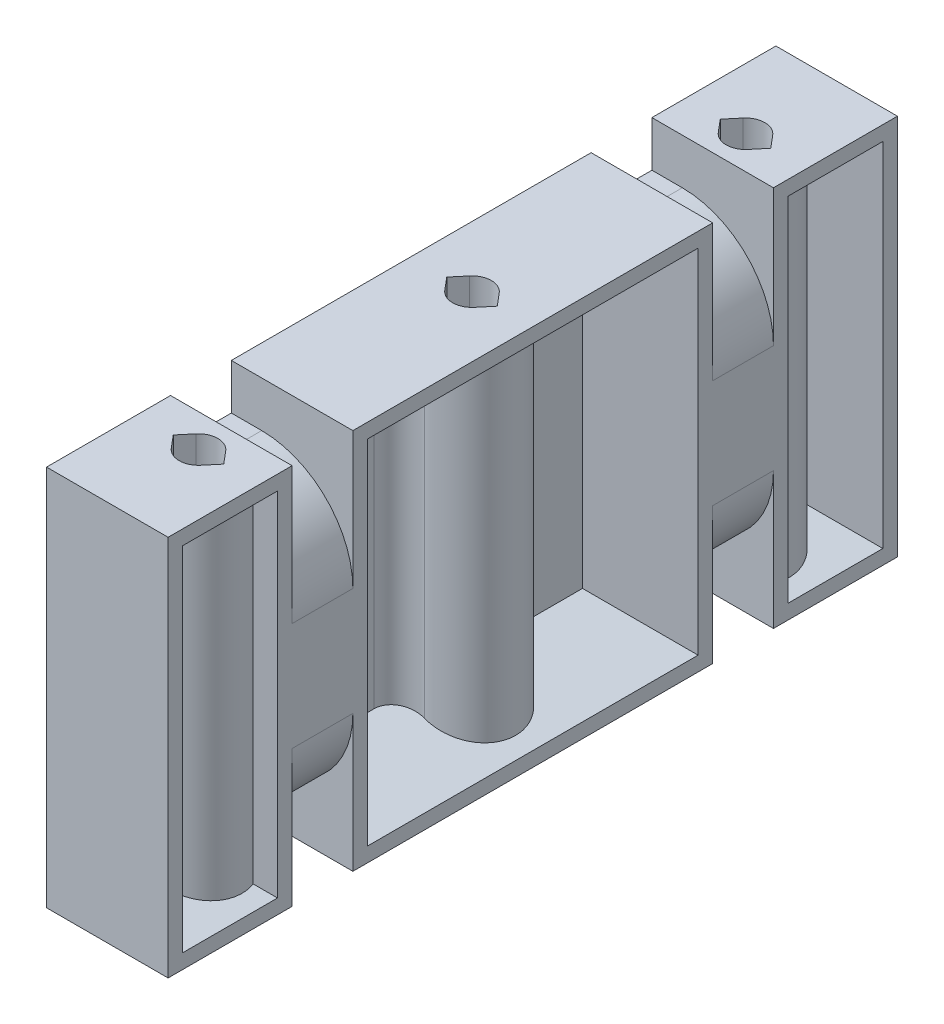
from build123d import *

# Parameters (mm, degrees)
SKETCH1_W                    = 76.2
SKETCH1_H                    = 39.878
BOSS_EXTRUDE1_DEPTH          = 12.7
SKETCH2_W                    = 6.35
SKETCH2_H                    = 4.7625
CUT_EXTRUDE1_DEPTH           = 45.83819489
F_10_32_TAPPED_HOLE1_D       = 4.0386
FILLET1_R                    = 9.525
SKETCH6_W                    = 34.544
SKETCH6_H                    = 36.83
CUT_EXTRUDE3_DEPTH           = 9.525
CUT_EXTRUDE3_DRAFT           = -15
SKETCH6_W_2                  = 9.906
CUT_EXTRUDE3_PROFILE_2_DEPTH = 9.525
CUT_EXTRUDE3_PROFILE_2_DRAFT = -15
CUT_EXTRUDE3_PROFILE_3_DEPTH = 9.525
CUT_EXTRUDE3_PROFILE_3_DRAFT = -15
SKETCH7_R                    = 4.5593
SKETCH7_R_2                  = 2.0193
EXTRUDE_THIN1_DEPTH          = 39.878
DELETEFACE1_START            = 18.796
DELETEFACE1_DEPTH            = 6.35
DELETEFACE1_START_2          = -25.146
DELETEFACE1_2_DEPTH          = 6.35
FILLET2_R                    = 2.54
CUT_EXTRUDE4_DEPTH           = 57.596421146


with BuildPart() as part:
    # Sketch1 → Boss-Extrude1 (new body)
    with BuildSketch(Plane(origin=(0, 0, 0), x_dir=(0, 0, -1), z_dir=(1, 0, 0))):
        Rectangle(SKETCH1_W, SKETCH1_H)
    extrude(amount=BOSS_EXTRUDE1_DEPTH)

    # Sketch2 → Cut-Extrude1 (cut, through all)
    with BuildSketch(Plane(origin=(12.7, 0, 0), x_dir=(0, 0, -1), z_dir=(1, 0, 0))):
        with Locations((-21.971, 17.55775)):
            Rectangle(SKETCH2_W, SKETCH2_H)
        with Locations((21.971, 17.55775)):
            Rectangle(SKETCH2_W, SKETCH2_H)
        with Locations((-21.971, -17.55775)):
            Rectangle(SKETCH2_W, SKETCH2_H)
        with Locations((21.971, -17.55775)):
            Rectangle(SKETCH2_W, SKETCH2_H)
    extrude(amount=-CUT_EXTRUDE1_DEPTH, mode=Mode.SUBTRACT)

    # #10-32 Tapped Hole1 (through all)
    with Locations(Plane(origin=(0, 19.939, 0), x_dir=(1, 0, 0), z_dir=(0, 1, 0))):
        with Locations((6.35, 28.575), (6.35, 0), (6.35, -28.575)):
            Hole(F_10_32_TAPPED_HOLE1_D / 2)

    # Fillet1
    fillet1_edges = [part.edges().sort_by_distance(p)[0] for p in [
        (12.7, 15.1765, -21.971),
        (12.7, -15.1765, 21.971),
        (12.7, -15.1765, -21.971),
        (12.7, 15.1765, 21.971),
    ]]
    fillet(fillet1_edges, radius=FILLET1_R)


with BuildPart() as cut_extrude3_tool:
    # Sketch6 → Cut-Extrude3 (with draft: the straight prism first)
    with BuildSketch(Plane(origin=(12.7, 0, 0), x_dir=(0, 0, -1), z_dir=(1, 0, 0))):
        Rectangle(SKETCH6_W, SKETCH6_H)
    extrude(amount=-CUT_EXTRUDE3_DEPTH)
    # Cut-Extrude3: the draft: its side faces are tilted about the plane it starts from
    cut_extrude3_sides = [cut_extrude3_tool.faces().sort_by_distance(p)[0] for p in [
        (7.9375, 0, 17.272),
        (7.9375, -18.415, 0),
        (7.9375, 0, -17.272),
        (7.9375, 18.415, 0),
    ]]
    draft(cut_extrude3_sides, Plane(origin=(12.7, 0, 0), x_dir=(0, 0, -1), z_dir=(1, 0, 0)), CUT_EXTRUDE3_DRAFT)


with BuildPart() as part_1:
    add(part.part)

    # Cut-Extrude3: cut by cut_extrude3_tool
    add(cut_extrude3_tool.part, mode=Mode.SUBTRACT)


with BuildPart() as cut_extrude3_profile_2_tool:
    # Sketch6 → Cut-Extrude3 profile 2 (with draft: the straight prism first)
    with BuildSketch(Plane(origin=(12.7, 0, 0), x_dir=(0, 0, -1), z_dir=(1, 0, 0))):
        with Locations((31.623, 0)):
            Rectangle(SKETCH6_W_2, SKETCH6_H)
    extrude(amount=-CUT_EXTRUDE3_PROFILE_2_DEPTH)
    # Cut-Extrude3 profile 2: the draft: its side faces are tilted about the plane it starts from
    cut_extrude3_profile_2_sides = [cut_extrude3_profile_2_tool.faces().sort_by_distance(p)[0] for p in [
        (7.9375, 0, -26.67),
        (7.9375, -18.415, -31.623),
        (7.9375, 0, -36.576),
        (7.9375, 18.415, -31.623),
    ]]
    draft(cut_extrude3_profile_2_sides, Plane(origin=(12.7, 0, 0), x_dir=(0, 0, -1), z_dir=(1, 0, 0)), CUT_EXTRUDE3_PROFILE_2_DRAFT)


with BuildPart() as part_2:
    add(part_1.part)

    # Cut-Extrude3 profile 2: cut by cut_extrude3_profile_2_tool
    add(cut_extrude3_profile_2_tool.part, mode=Mode.SUBTRACT)


with BuildPart() as cut_extrude3_profile_3_tool:
    # Sketch6 → Cut-Extrude3 profile 3 (with draft: the straight prism first)
    with BuildSketch(Plane(origin=(12.7, 0, 0), x_dir=(0, 0, -1), z_dir=(1, 0, 0))):
        with Locations((-31.623, 0)):
            Rectangle(SKETCH6_W_2, SKETCH6_H)
    extrude(amount=-CUT_EXTRUDE3_PROFILE_3_DEPTH)
    # Cut-Extrude3 profile 3: the draft: its side faces are tilted about the plane it starts from
    cut_extrude3_profile_3_sides = [cut_extrude3_profile_3_tool.faces().sort_by_distance(p)[0] for p in [
        (7.9375, 0, 36.576),
        (7.9375, -18.415, 31.623),
        (7.9375, 0, 26.67),
        (7.9375, 18.415, 31.623),
    ]]
    draft(cut_extrude3_profile_3_sides, Plane(origin=(12.7, 0, 0), x_dir=(0, 0, -1), z_dir=(1, 0, 0)), CUT_EXTRUDE3_PROFILE_3_DRAFT)


with BuildPart() as part_3:
    add(part_2.part)

    # Cut-Extrude3 profile 3: cut by cut_extrude3_profile_3_tool
    add(cut_extrude3_profile_3_tool.part, mode=Mode.SUBTRACT)

    # Sketch7 → Extrude-Thin1 (add, through all)
    # profile 1 of 3: a face of its own
    with BuildSketch(Plane(origin=(0, 19.939, 0), x_dir=(1, 0, 0), z_dir=(0, 1, 0))):
        with Locations((6.35, -28.575)):
            Circle(SKETCH7_R)
        with Locations((6.35, -28.575)):
            Circle(SKETCH7_R_2, mode=Mode.SUBTRACT)
    # profile 2 of 3: a face of its own
    with BuildSketch(Plane(origin=(0, 19.939, 0), x_dir=(1, 0, 0), z_dir=(0, 1, 0))):
        with Locations((6.35, 0)):
            Circle(SKETCH7_R)
        with Locations((6.35, 0)):
            Circle(SKETCH7_R_2, mode=Mode.SUBTRACT)
    # profile 3 of 3: a face of its own
    with BuildSketch(Plane(origin=(0, 19.939, 0), x_dir=(1, 0, 0), z_dir=(0, 1, 0))):
        with Locations((6.35, 28.575)):
            Circle(SKETCH7_R)
        with Locations((6.35, 28.575)):
            Circle(SKETCH7_R_2, mode=Mode.SUBTRACT)
    extrude(amount=-EXTRUDE_THIN1_DEPTH)

    # DeleteFace1: read off the stored shape, not the designer's step
    # DeleteFace1 outline → DeleteFace1 (cut)
    with BuildSketch(Plane.XY.offset(DELETEFACE1_START)):
        with BuildLine():
            ThreePointArc((3.175, 15.1765), (9.910192091, 12.386692091), (12.7, 5.6515))
            Line((12.7, 5.6515), (12.7, 19.939))
            Line((12.7, 19.939), (0, 19.939))
            Line((0, 19.939), (0, 15.1765))
            Line((0, 15.1765), (3.175, 15.1765))
        make_face()
        with BuildLine():
            Line((12.7, -19.939), (12.7, -5.6515))
            ThreePointArc((12.7, -5.6515), (9.910192091, -12.386692091), (3.175, -15.1765))
            Line((3.175, -15.1765), (0, -15.1765))
            Line((0, -15.1765), (0, -19.939))
            Line((0, -19.939), (12.7, -19.939))
        make_face()
    extrude(amount=DELETEFACE1_DEPTH, mode=Mode.SUBTRACT)

    # DeleteFace1 2 outline → DeleteFace1 2 (cut)
    with BuildSketch(Plane.XY.offset(DELETEFACE1_START_2)):
        with BuildLine():
            ThreePointArc((3.175, 15.1765), (9.910192091, 12.386692091), (12.7, 5.6515))
            Line((12.7, 5.6515), (12.7, 19.939))
            Line((12.7, 19.939), (0, 19.939))
            Line((0, 19.939), (0, 15.1765))
            Line((0, 15.1765), (3.175, 15.1765))
        make_face()
        with BuildLine():
            Line((12.7, -19.939), (12.7, -5.6515))
            ThreePointArc((12.7, -5.6515), (9.910192091, -12.386692091), (3.175, -15.1765))
            Line((3.175, -15.1765), (0, -15.1765))
            Line((0, -15.1765), (0, -19.939))
            Line((0, -19.939), (12.7, -19.939))
        make_face()
    extrude(amount=DELETEFACE1_2_DEPTH, mode=Mode.SUBTRACT)

    # Fillet2
    # the kernel refuses this fillet: 2.54 mm, written as the material it adds along each edge
    with BuildSketch(Plane(origin=(3.175, -25.359661976, -3.27209283), x_dir=(0, 0, -1), z_dir=(0, 1, 0))) as fillet2_piece_1_section:
        with BuildLine():
            CenterArc((3.798751213, -2.54), FILLET2_R, 90, 95.131704374)
            ThreePointArc((1.268932235, -2.767191413), (0.872245463, -1.274558842), (0, 0))
            Line((0, 0), (3.798751213, 0))
        make_face()
    fillet2_piece_1 = extrude(amount=50.719323951, mode=Mode.PRIVATE)
    fillet2_piece_1 = split(fillet2_piece_1, bisect_by=Plane(origin=(5.549219508, -16.498954142, -3.27209283), z_dir=(0.25881904510252135, 0.9659258262890681, 0)), keep=Keep.TOP, mode=Mode.PRIVATE)
    fillet2_piece_1 = split(fillet2_piece_1, bisect_by=Plane(origin=(-7.130611479, 13.101403669, -3.27209283), z_dir=(0.25881904510252135, -0.9659258262890681, 0)), keep=Keep.TOP, mode=Mode.PRIVATE)
    add(fillet2_piece_1)
    with BuildSketch(Plane(origin=(3.175, -25.359661976, 3.27209283), x_dir=(0.9089856543258207, 0, 0.4168273986074566), z_dir=(0, 1, 0))) as fillet2_piece_2_section:
        with BuildLine():
            CenterArc((3.892247148, -2.394268765), FILLET2_R, 109.502744929, 95.131704374)
            Line((1.583423586, -3.453010357), (0, 0))
            ThreePointArc((0, 0), (1.52213151, -0.261587567), (3.04426302, 0))
        make_face()
    fillet2_piece_2 = extrude(amount=50.719323951, mode=Mode.PRIVATE)
    fillet2_piece_2 = split(fillet2_piece_2, bisect_by=Plane(origin=(5.549219508, -16.498954142, 3.27209283), z_dir=(0.25881904510252135, 0.9659258262890681, 0)), keep=Keep.TOP, mode=Mode.PRIVATE)
    fillet2_piece_2 = split(fillet2_piece_2, bisect_by=Plane(origin=(-7.130611479, 13.101403669, 3.27209283), z_dir=(0.25881904510252135, -0.9659258262890681, 0)), keep=Keep.TOP, mode=Mode.PRIVATE)
    add(fillet2_piece_2)
    with BuildSketch(Plane(origin=(3.175, -22.657937307, -31.84709283), x_dir=(0, 0, -1), z_dir=(0, 1, 0))) as fillet2_piece_3_section:
        with BuildLine():
            CenterArc((3.73080949, -2.009058502), FILLET2_R, 127.723943203, 61.728755264)
            ThreePointArc((1.225298821, -2.426211095), (0.797654993, -1.119672984), (0, 0))
            Line((0, 0), (2.176691112, 0))
        make_face()
    fillet2_piece_3 = extrude(amount=45.315874614, mode=Mode.PRIVATE)
    fillet2_piece_3 = split(fillet2_piece_3, bisect_by=Plane(origin=(4.873788341, -16.317972906, -31.84709283), z_dir=(0.25881904510252135, 0.9659258262890681, 0)), keep=Keep.TOP, mode=Mode.PRIVATE)
    fillet2_piece_3 = split(fillet2_piece_3, bisect_by=Plane(origin=(-6.455180312, 13.282384904, -31.84709283), z_dir=(0.25881904510252135, -0.9659258262890681, 0)), keep=Keep.TOP, mode=Mode.PRIVATE)
    add(fillet2_piece_3)
    with BuildSketch(Plane(origin=(3.175, -22.657937307, 31.84709283), x_dir=(0.8926255836617852, 0, 0.4507988103272426), z_dir=(0, 1, 0))) as fillet2_piece_4_section:
        with BuildLine():
            CenterArc((3.475181498, -2.424534816), FILLET2_R, 107.342247882, 61.728755264)
            Line((0.981249764, -1.942970174), (0, 0))
            ThreePointArc((0, 0), (1.359030673, -0.207260005), (2.718061346, 0))
        make_face()
    fillet2_piece_4 = extrude(amount=45.315874614, mode=Mode.PRIVATE)
    fillet2_piece_4 = split(fillet2_piece_4, bisect_by=Plane(origin=(-6.455180312, 13.282384904, 31.84709283), z_dir=(0.25881904510252135, -0.9659258262890681, 0)), keep=Keep.TOP, mode=Mode.PRIVATE)
    fillet2_piece_4 = split(fillet2_piece_4, bisect_by=Plane(origin=(4.873788341, -16.317972906, 31.84709283), z_dir=(0.25881904510252135, 0.9659258262890681, 0)), keep=Keep.TOP, mode=Mode.PRIVATE)
    add(fillet2_piece_4)

    # Sketch8 → Cut-Extrude4 (cut, through all)
    with BuildSketch(Plane.XZ.offset(19.939)):
        with BuildLine():
            Line((8.986008939, 28.575), (7.896873544, 29.87298102))
            ThreePointArc((7.896873544, 29.87298102), (6.35, 30.5943), (4.803126456, 29.87298102))
            Line((4.803126456, 29.87298102), (3.713991061, 28.575))
            Line((3.713991061, 28.575), (4.803126456, 27.27701898))
            ThreePointArc((4.803126456, 27.27701898), (6.35, 26.5557), (7.896873544, 27.27701898))
            Line((7.896873544, 27.27701898), (8.986008939, 28.575))
        make_face()
        with BuildLine():
            Line((8.986008939, 0), (7.896873544, 1.29798102))
            ThreePointArc((7.896873544, 1.29798102), (6.35, 2.0193), (4.803126456, 1.29798102))
            Line((4.803126456, 1.29798102), (3.713991061, 0))
            Line((3.713991061, 0), (4.803126456, -1.29798102))
            ThreePointArc((4.803126456, -1.29798102), (6.35, -2.0193), (7.896873544, -1.29798102))
            Line((7.896873544, -1.29798102), (8.986008939, 0))
        make_face()
        with BuildLine():
            Line((8.986008939, -28.575), (7.896873544, -27.27701898))
            ThreePointArc((7.896873544, -27.27701898), (6.35, -26.5557), (4.803126456, -27.27701898))
            Line((4.803126456, -27.27701898), (3.713991061, -28.575))
            Line((3.713991061, -28.575), (4.803126456, -29.87298102))
            ThreePointArc((4.803126456, -29.87298102), (6.35, -30.5943), (7.896873544, -29.87298102))
            Line((7.896873544, -29.87298102), (8.986008939, -28.575))
        make_face()
    extrude(amount=-CUT_EXTRUDE4_DEPTH, mode=Mode.SUBTRACT)


solid = part_3.part
